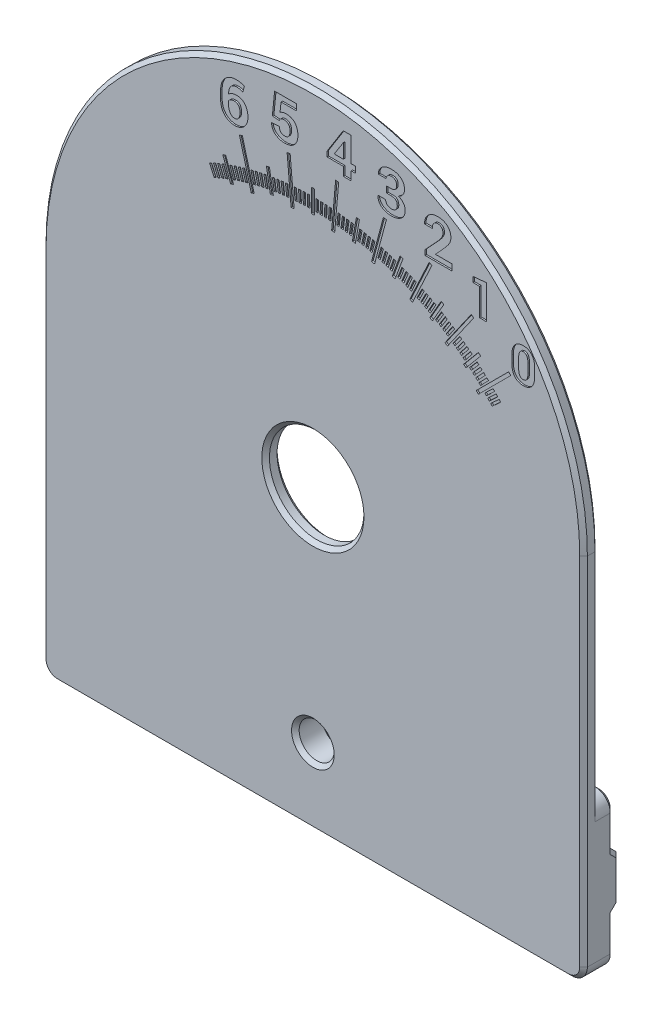
from build123d import *

# Parameters (mm, degrees)
AUFSATZ_LINEAR_AUSTRAGEN1_DEPTH      = 2
SCHNITT_LINEAR_AUSTRAGEN1_DEPTH      = 0.2
SKIZZE4_R                            = 6.2
SCHNITT_LINEAR_AUSTRAGEN2_DEPTH      = 74.378055608
SCHNITT_LINEAR_AUSTRAGEN3_DEPTH      = 0.2
AUFSATZ_LINEAR_AUSTRAGEN2_DEPTH      = 2
AUFSATZ_LINEAR_AUSTRAGEN2_DEPTH_BACK = 2
AUFSATZ_LINEAR_AUSTRAGEN3_DEPTH      = 71
SKIZZE6_R                            = 2.3
SCHNITT_LINEAR_AUSTRAGEN4_DEPTH      = 74.504432279
SKIZZE7_R                            = 4.15
SCHNITT_LINEAR_AUSTRAGEN5_DEPTH      = 2
VERRUNDUNG1_R                        = 1
VERRUNDUNG2_R                        = 2
FASE1_SIZE                           = 0.5


with BuildPart() as part:
    # Skizze1 → Aufsatz-Linear austragen1 (new body)
    with BuildSketch(Plane.XY):
        with BuildLine():
            Line((-35.5, 0), (0, 0))
            Line((0, 0), (35.5, 0))
            Line((35.5, 0), (35.5, 28.687919773))
            ThreePointArc((35.5, 28.687919773), (25.102290732, 53.790210505), (0, 64.187919773))
            ThreePointArc((0, 64.187919773), (-25.102290732, 53.790210505), (-35.5, 28.687919773))
            Line((-35.5, 28.687919773), (-35.5, 0))
        make_face()
    extrude(amount=AUFSATZ_LINEAR_AUSTRAGEN1_DEPTH)

    # Skizze2 → Schnitt-Linear austragen1 (cut)
    with BuildSketch(Plane.XY.offset(2)):
        Polygon((2.857489093, 49.366507143), (3.38042355, 55.343675332), (3.18118461, 55.36110648), (2.981945671, 55.378537629), (2.459011214, 49.40136944), align=None)
        Polygon((2.30193872, 51.919257384), (2.451573328, 51.908793913), (2.346938617, 50.412447837), (2.047669402, 50.433374779), (2.152304113, 51.929720855), align=None)
        Polygon((1.577273434, 51.962268385), (1.4987695, 50.464324083), (1.79835836, 50.448623296), (1.876862295, 51.946567598), (1.727067865, 51.954417991), align=None)
        Polygon((1.001762303, 51.984775289), (0.949413058, 50.485689048), (1.249230306, 50.475219199), (1.301579551, 51.97430544), (1.151670927, 51.979540364), align=None)
        Polygon((0.575923179, 51.99461685), (0.725900334, 51.991998989), (0.699721724, 50.492227446), (0.399767415, 50.497463168), (0.425946025, 51.997234711), align=None)
        Polygon((0, 53), (0.2, 53), (0.2, 50), (-0.2, 50), (-0.2, 53), align=None)
        Polygon((-2.451573328, 51.908793913), (-2.346938617, 50.412447837), (-2.047669402, 50.433374779), (-2.152304113, 51.929720855), (-2.30193872, 51.919257384), align=None)
        Polygon((-1.727067864, 51.954417991), (-1.577273434, 51.962268385), (-1.4987695, 50.464324083), (-1.79835836, 50.448623296), (-1.876862295, 51.946567598), align=None)
        Polygon((-1.151670927, 51.979540364), (-1.001762303, 51.984775289), (-0.949413058, 50.485689048), (-1.249230306, 50.475219199), (-1.301579551, 51.97430544), align=None)
        Polygon((-0.575923179, 51.99461685), (-0.425946025, 51.997234711), (-0.399767415, 50.497463168), (-0.699721724, 50.492227446), (-0.725900334, 51.991998989), align=None)
        Polygon((-2.459011214, 49.40136944), (-2.981945671, 55.378537629), (-3.18118461, 55.36110648), (-3.38042355, 55.343675332), (-2.857489093, 49.366507143), align=None)
        Polygon((-5.162281477, 51.593362492), (-5.014128225, 51.616827662), (-4.779476528, 50.135295151), (-5.07578303, 50.088364811), (-5.310434728, 51.569897322), align=None)
        Polygon((-4.592662627, 51.678492599), (-4.444122416, 51.699368564), (-4.235362765, 50.213966461), (-4.532443186, 50.172214531), (-4.741202837, 51.657616634), align=None)
        Polygon((-4.021644807, 51.753668521), (-3.872762885, 51.771948923), (-3.689958869, 50.283129695), (-3.987722715, 50.246568892), (-4.17052673, 51.73538812), align=None)
        Polygon((-3.449401956, 51.818867359), (-3.300223672, 51.834546628), (-3.143430977, 50.342763785), (-3.441787545, 50.311405246), (-3.59858024, 51.803188089), align=None)
        Polygon((-6.100999591, 52.448733967), (-5.580055058, 49.494310708), (-5.186131957, 49.563769979), (-5.70707649, 52.518193238), (-5.904038041, 52.483463602), align=None)
        Polygon((-7.70079571, 48.512501511), (-8.087166041, 48.408973893), (-9.640080311, 54.204528851), (-9.446895146, 54.25629266), (-9.253709981, 54.308056469), align=None)
        Polygon((-7.983336154, 51.019412431), (-7.837791795, 51.055700715), (-7.474908951, 49.600257126), (-7.765997669, 49.527680557), (-8.128880513, 50.983124147), align=None)
        Polygon((-7.423304453, 51.153864147), (-7.277148944, 51.187606805), (-6.939722362, 49.726051708), (-7.232033381, 49.658566391), (-7.569459963, 51.120121488), align=None)
        Polygon((-6.861011542, 51.278521484), (-6.714289402, 51.309708237), (-6.402421866, 49.842486836), (-6.695866146, 49.780113329), (-7.007733682, 51.24733473), align=None)
        Polygon((-6.296628701, 51.393346471), (-6.149384623, 51.42196782), (-5.86317113, 49.949527045), (-6.157659285, 49.892284346), (-6.443872778, 51.364725121), align=None)
        Polygon((-11.628684873, 50.949549107), (-11.440746349, 51.017953135), (-10.414685919, 48.198875273), (-10.790562967, 48.062067216), (-11.816623397, 50.881145078), align=None)
        Polygon((-10.743632822, 50.201775308), (-10.601805036, 50.250610531), (-10.113452804, 48.832332667), (-10.397108377, 48.734662221), (-10.885460608, 50.152940084), align=None)
        Polygon((-10.197450451, 50.384525373), (-10.054791973, 50.430877922), (-9.591266482, 49.004293147), (-9.876583436, 48.911588049), (-10.340108928, 50.338172824), align=None)
        Polygon((-9.648161837, 50.557715407), (-9.504716123, 50.601571163), (-9.066158566, 49.167114029), (-9.353049993, 49.079402518), (-9.79160755, 50.513859652), align=None)
        Polygon((-9.095934299, 50.721292656), (-8.951745045, 50.76263826), (-8.538289011, 49.320745716), (-8.82666752, 49.238054509), (-9.240123554, 50.679947053), align=None)
        Polygon((-13.422163958, 49.146673834), (-13.285132139, 49.207684331), (-12.675027174, 47.837366144), (-12.949090812, 47.715345151), (-13.559195776, 49.085663338), align=None)
        Polygon((-12.893987693, 49.37633141), (-12.755911964, 49.43494108), (-12.169815272, 48.054183799), (-12.445966728, 47.936964461), (-13.032063421, 49.317721741), align=None)
        Polygon((-12.361883794, 49.596736062), (-12.222806216, 49.652927051), (-11.660896326, 48.262151269), (-11.939051482, 48.149769291), (-12.500961372, 49.540545073), align=None)
        Polygon((-11.826014346, 49.807820651), (-11.685977282, 49.861575843), (-11.148425357, 48.461205204), (-11.428499485, 48.353694819), (-11.96605141, 49.754065458), align=None)
        Polygon((3.300223672, 51.834546628), (3.143430977, 50.342763785), (3.441787545, 50.311405246), (3.59858024, 51.803188089), (3.449401956, 51.818867359), align=None)
        Polygon((4.021644807, 51.753668521), (4.17052673, 51.73538812), (3.987722715, 50.246568892), (3.68995887, 50.283129695), (3.872762885, 51.771948923), align=None)
        Polygon((4.592662627, 51.678492599), (4.741202837, 51.657616634), (4.532443186, 50.172214531), (4.235362765, 50.213966461), (4.444122416, 51.699368564), align=None)
        Polygon((5.162281477, 51.593362492), (5.310434728, 51.569897322), (5.07578303, 50.088364811), (4.779476528, 50.135295151), (5.014128225, 51.616827662), align=None)
        Polygon((5.70707649, 52.518193238), (5.186131957, 49.563769979), (5.580055058, 49.494310708), (6.100999591, 52.448733967), (5.904038041, 52.483463602), align=None)
        Polygon((6.296628701, 51.393346471), (6.443872778, 51.364725121), (6.157659285, 49.892284346), (5.86317113, 49.949527045), (6.149384623, 51.42196782), align=None)
        Polygon((6.861011542, 51.278521484), (7.007733683, 51.24733473), (6.695866146, 49.780113329), (6.402421866, 49.842486836), (6.714289402, 51.309708237), align=None)
        Polygon((7.423304453, 51.153864147), (7.569459963, 51.120121488), (7.232033381, 49.658566391), (6.939722362, 49.726051708), (7.277148944, 51.187606805), align=None)
        Polygon((7.983336154, 51.019412431), (8.128880513, 50.983124147), (7.765997669, 49.527680557), (7.474908951, 49.600257126), (7.837791795, 51.055700715), align=None)
        Polygon((8.087166041, 48.408973893), (9.640080312, 54.204528851), (9.446895146, 54.25629266), (9.253709981, 54.308056469), (7.70079571, 48.512501511), align=None)
        Polygon((9.0959343, 50.721292656), (9.240123554, 50.679947053), (8.82666752, 49.238054509), (8.538289011, 49.320745716), (8.951745045, 50.76263826), align=None)
        Polygon((9.648161837, 50.557715407), (9.79160755, 50.513859652), (9.353049993, 49.079402518), (9.066158566, 49.167114029), (9.504716123, 50.601571163), align=None)
        Polygon((10.197450451, 50.384525373), (10.340108928, 50.338172824), (9.876583436, 48.911588049), (9.591266482, 49.004293147), (10.054791973, 50.430877922), align=None)
        Polygon((10.743632822, 50.201775308), (10.885460608, 50.152940084), (10.397108377, 48.734662221), (10.113452804, 48.832332667), (10.601805036, 50.250610531), align=None)
        Polygon((11.628684873, 50.949549107), (11.816623397, 50.881145078), (10.790562967, 48.062067216), (10.414685919, 48.198875273), (11.440746349, 51.017953135), align=None)
        Polygon((11.826014346, 49.807820651), (11.96605141, 49.754065458), (11.428499485, 48.353694819), (11.148425357, 48.461205204), (11.685977282, 49.861575843), align=None)
        Polygon((12.361883794, 49.596736062), (12.500961372, 49.540545073), (11.939051482, 48.149769291), (11.660896326, 48.262151269), (12.222806216, 49.652927051), align=None)
        Polygon((12.893987693, 49.37633141), (13.032063421, 49.317721741), (12.445966728, 47.936964461), (12.169815272, 48.054183799), (12.755911965, 49.43494108), align=None)
        Polygon((13.422163958, 49.146673834), (13.559195776, 49.085663338), (12.949090812, 47.715345151), (12.675027174, 47.837366144), (13.285132139, 49.207684331), align=None)
        Polygon((13.071118541, 46.557863852), (12.708595426, 46.726911157), (15.244304996, 52.164757879), (15.425566554, 52.080234227), (15.606828111, 51.995710574), align=None)
        Polygon((21.854778729, 45.045511066), (22.007987618, 44.916953544), (20.079624789, 42.618820215), (19.773207012, 42.875935259), (21.701569841, 45.174068588), align=None)
        Polygon((20.767348146, 44.645539174), (20.88392004, 44.551141116), (19.939939454, 43.385422174), (19.706795665, 43.574218291), (20.650776252, 44.739937233), align=None)
        Polygon((20.316608805, 45.004073435), (20.434810418, 44.911724214), (19.511318205, 43.729708083), (19.274914979, 43.914406526), (20.198407192, 45.096422656), align=None)
        Polygon((19.859680829, 45.354686603), (19.979476155, 45.264414349), (19.076753621, 44.066461084), (18.837162968, 44.247005591), (19.739885502, 45.444958856), align=None)
        Polygon((19.396703401, 45.697271878), (19.51805595, 45.60910409), (18.636378072, 44.395578599), (18.393672974, 44.571914174), (19.275350852, 45.785439666), align=None)
        Polygon((17.657911718, 43.869422064), (17.3302509, 44.098852638), (20.771709518, 49.013764904), (20.935539927, 48.899049617), (21.099370336, 48.784334329), align=None)
        Polygon((18.453166102, 46.357943808), (18.577521738, 46.274064872), (17.738732382, 45.030508513), (17.490021111, 45.198266384), (18.328810466, 46.441822743), align=None)
        Polygon((17.97289364, 46.675829215), (18.098694226, 46.59413336), (17.281735673, 45.336127508), (17.030134503, 45.499519219), (17.847093055, 46.757525071), align=None)
        Polygon((17.487146462, 46.985284297), (17.614353676, 46.905796407), (16.81947478, 45.633724263), (16.565060351, 45.792700043), (17.359939247, 47.064772187), align=None)
        Polygon((16.996072529, 47.28621479), (17.124647624, 47.208959079), (16.352090512, 45.923208128), (16.094940321, 46.07771955), (16.867497434, 47.363470501), align=None)
        Polygon((17, 48.444863729), (17.173205081, 48.344863729), (15.673205081, 45.746787517), (15.326794919, 45.946787517), (16.826794919, 48.544863729), align=None)
        Polygon((15.998544321, 47.86213797), (16.129737277, 47.789416527), (15.402522847, 46.477486966), (15.140136934, 46.622929852), (15.867351365, 47.934859413), align=None)
        Polygon((15.492393903, 48.136955224), (15.624836042, 48.06653449), (14.920628697, 46.7421131), (14.655744419, 46.882954569), (15.359951764, 48.207375959), align=None)
        Polygon((14.981524351, 48.40289708), (15.11517533, 48.334798505), (14.43418958, 46.998288719), (14.166887623, 47.134485868), (14.847873372, 48.470995655), align=None)
        Polygon((14.466091282, 48.659882528), (14.600910389, 48.594126856), (13.943353669, 47.245935787), (13.673715455, 47.377447131), (14.331272175, 48.7256382), align=None)
        Polygon((24.52351383, 41.081071033), (24.623883421, 40.969599309), (23.509166183, 39.9659034), (23.308427001, 40.188846848), (24.423144239, 41.192542757), align=None)
        Polygon((24.134410954, 41.50570231), (24.236710708, 41.395999255), (23.139680156, 40.373001714), (22.935080648, 40.592407825), (24.0321112, 41.615405365), align=None)
        Polygon((23.737956503, 41.923478131), (23.842155258, 41.815577161), (22.763145558, 40.773589606), (22.554748047, 40.989391546), (23.633757747, 42.031379102), align=None)
        Polygon((21.42533547, 40.708178182), (25.667976157, 44.95081887), (25.809397513, 44.809397513), (25.95081887, 44.667976157), (21.708178182, 40.42533547), align=None)
        Polygon((22.923478131, 42.737956503), (23.031379102, 42.633757747), (21.989391546, 41.554748047), (21.773589606, 41.763145558), (22.815577161, 42.842155258), align=None)
        Polygon((22.50570231, 43.134410954), (22.615405365, 43.0321112), (21.592407825, 41.935080648), (21.373001715, 42.139680156), (22.395999255, 43.236710708), align=None)
        Polygon((22.081071033, 43.52351383), (22.192542757, 43.423144239), (21.188846848, 42.308427001), (20.9659034, 42.509166183), (21.969599309, 43.623883421), align=None)
        Polygon((21.649713649, 43.905146607), (21.762920086, 43.806737752), (20.778831542, 42.674673382), (20.552418668, 42.871491091), (21.536507212, 44.003555461), align=None)
    extrude(amount=-SCHNITT_LINEAR_AUSTRAGEN1_DEPTH, mode=Mode.SUBTRACT)

    # Skizze4 → Schnitt-Linear austragen2 (cut, through all)
    with BuildSketch(Plane.XY.offset(2)):
        with Locations((0, 19)):
            Circle(SKIZZE4_R)
    extrude(amount=-SCHNITT_LINEAR_AUSTRAGEN2_DEPTH, mode=Mode.SUBTRACT)

    # Skizze3 → Schnitt-Linear austragen3 (cut)
    # profile 1 of 7: a face of its own
    with BuildSketch(Plane.XY.offset(2)):
        with BuildLine():
            add(Edge.make_bspline(
                [(26.098559086, 46.122833513), (26.099690166, 46.051677694), (26.101885004, 45.913601231), (26.121026395, 45.713253722), (26.152043006, 45.52629491), (26.196004084, 45.352412786), (26.252740372, 45.19186021), (26.320749425, 45.043645185), (26.403490685, 44.909590132), (26.49781734, 44.788606495), (26.603615057, 44.682414187), (26.718008102, 44.589320208), (26.841672199, 44.510987764), (26.974148357, 44.446503401), (27.115528963, 44.39680547), (27.265917532, 44.362259655), (27.424999392, 44.339856432), (27.53420902, 44.337338229), (27.590096119, 44.336049559)],
                knots=[0, 0, 0, 0, 1.293224978, 2.509477586, 3.654535947, 4.735320651, 5.765195443, 6.746129847, 7.69374496, 8.622268829, 9.528613081, 10.412810147, 11.297982386, 12.183473846, 13.085672909, 14.015733381, 14.984568415, 16, 16, 16, 16], degree=3))
            add(Edge.make_bspline(
                [(27.590096119, 44.336049559), (27.646279821, 44.337358967), (27.756377811, 44.33992489), (27.91668914, 44.362135198), (28.06849625, 44.396976301), (28.211161218, 44.4463415), (28.344706398, 44.510678307), (28.468601838, 44.589925111), (28.584608654, 44.681757974), (28.690387659, 44.788703831), (28.784890174, 44.90953368), (28.867343359, 45.04388412), (28.936693709, 45.191605696), (28.993108202, 45.352451378), (29.03717433, 45.526283687), (29.068160373, 45.713256994), (29.087310564, 45.91360033), (29.089504149, 46.051677388), (29.090634583, 46.122833513)],
                knots=[0, 0, 0, 0, 1.017853048, 1.994592204, 2.927189021, 3.836976819, 4.724735696, 5.607282636, 6.497337057, 7.400993217, 8.32676321, 9.271567827, 10.251903337, 11.278723662, 12.356302906, 13.497965181, 14.71061055, 16, 16, 16, 16], degree=3))
            Line((29.090634583, 46.122833513), (29.090634583, 47.097688435))
            add(Edge.make_bspline(
                [(29.090634583, 47.097688435), (29.08950819, 47.168545082), (29.087322711, 47.306024364), (29.068095523, 47.505760148), (29.03716009, 47.692429838), (28.993174126, 47.866299805), (28.93650274, 48.02689257), (28.868165463, 48.17520072), (28.786035047, 48.309949966), (28.691068356, 48.431025758), (28.585653194, 48.538137334), (28.471157819, 48.631960182), (28.347641387, 48.711799546), (28.214103367, 48.775275102), (28.072735275, 48.826906497), (27.921708286, 48.860737815), (27.762111817, 48.883458088), (27.652590286, 48.885913168), (27.59639712, 48.887172818)],
                knots=[0, 0, 0, 0, 1.286043053, 2.495239076, 3.63875912, 4.718091855, 5.746583072, 6.726199649, 7.677185986, 8.604462438, 9.513465084, 10.399911598, 11.286826565, 12.176030047, 13.078842803, 14.012957188, 14.980490652, 16, 16, 16, 16], degree=3))
            add(Edge.make_bspline(
                [(27.59639712, 48.887172818), (27.540507987, 48.885889332), (27.431294384, 48.883381258), (27.272240914, 48.860905696), (27.121376544, 48.826533717), (26.980017314, 48.775713334), (26.846716971, 48.711595899), (26.723312108, 48.631401421), (26.607154543, 48.538822666), (26.501904537, 48.430631338), (26.405592938, 48.310358031), (26.324201284, 48.174676549), (26.253025028, 48.027433216), (26.197354237, 47.866072959), (26.151669495, 47.692611816), (26.121207265, 47.505728828), (26.101840971, 47.30603297), (26.09967528, 47.168548009), (26.098559086, 47.097688435)],
                knots=[0, 0, 0, 0, 1.013603384, 1.980694112, 2.909080086, 3.816605871, 4.700503077, 5.587012198, 6.481510149, 7.390096843, 8.320316897, 9.27086807, 10.254687322, 11.282707909, 12.362905948, 13.505902726, 14.71454543, 16, 16, 16, 16], degree=3))
            Line((26.098559086, 47.097688435), (26.098559086, 46.122833513))
        make_face()
        with BuildLine():
            add(Edge.make_bspline(
                [(26.982499561, 47.186802597), (26.983079851, 47.228817086), (26.984204014, 47.310209333), (26.991051042, 47.428020495), (27.003790108, 47.537037085), (27.02040355, 47.637596472), (27.042970356, 47.729270139), (27.069461951, 47.812690551), (27.101950091, 47.886799394), (27.138958077, 47.95235282), (27.180725085, 48.009688488), (27.22687911, 48.05962675), (27.277411162, 48.102391648), (27.332868177, 48.137023419), (27.392818673, 48.162972575), (27.456823872, 48.182118858), (27.525136363, 48.194107292), (27.57234363, 48.195270346), (27.59639712, 48.195862956)],
                knots=[0, 0, 0, 0, 1.513594036, 2.932198428, 4.248801102, 5.466039263, 6.601180113, 7.647133637, 8.615119174, 9.510694161, 10.353858007, 11.16459791, 11.954831597, 12.731645245, 13.510861571, 14.300799512, 15.134207414, 16, 16, 16, 16], degree=3))
            add(Edge.make_bspline(
                [(27.59639712, 48.195862956), (27.620755768, 48.195298193), (27.668273169, 48.194196487), (27.737111088, 48.18193), (27.801315074, 48.163361539), (27.861059086, 48.136807317), (27.915931367, 48.102299347), (27.967145063, 48.060882612), (28.011918263, 48.01017537), (28.053981997, 47.953540953), (28.089947689, 47.887618948), (28.121089454, 47.813617565), (28.14854941, 47.730991063), (28.169232757, 47.639219462), (28.186789788, 47.538641769), (28.197694779, 47.429132412), (28.205129164, 47.31082466), (28.206160106, 47.229122305), (28.206694108, 47.186802597)],
                knots=[0, 0, 0, 0, 0.876860946, 1.710528188, 2.511074245, 3.280646496, 4.057701873, 4.841274337, 5.644953943, 6.488380164, 7.378933073, 8.342924242, 9.378929121, 10.511897991, 11.72951493, 13.056079329, 14.475125161, 16, 16, 16, 16], degree=3))
            Line((28.206694108, 47.186802597), (28.206694108, 46.041820638))
            add(Edge.make_bspline(
                [(28.206694108, 46.041820638), (28.206141222, 45.999203285), (28.205069672, 45.916606455), (28.19786326, 45.797368044), (28.186455019, 45.686749148), (28.169900737, 45.585280458), (28.146949204, 45.493189967), (28.121284761, 45.409498457), (28.090320804, 45.334621905), (28.052838378, 45.269119345), (28.011408837, 45.211841292), (27.964962232, 45.162299882), (27.913358706, 45.121190457), (27.857999487, 45.085877947), (27.797219665, 45.060302505), (27.732366847, 45.041090852), (27.662851893, 45.029069067), (27.614749213, 45.02793873), (27.590096119, 45.027359421)],
                knots=[0, 0, 0, 0, 1.523541514, 2.952780733, 4.26885555, 5.497995718, 6.624511075, 7.659241543, 8.625484964, 9.514254825, 10.351011797, 11.147758987, 11.933453846, 12.70436479, 13.487492611, 14.281708487, 15.119358806, 16, 16, 16, 16], degree=3))
            add(Edge.make_bspline(
                [(27.590096119, 45.027359421), (27.566041039, 45.027948511), (27.51883065, 45.029104654), (27.450540506, 45.041142563), (27.386719283, 45.060034469), (27.327292024, 45.086463398), (27.272320293, 45.120546822), (27.222417991, 45.16300088), (27.175873495, 45.211498281), (27.135486465, 45.26921702), (27.098931184, 45.334828305), (27.068160079, 45.409660032), (27.04079426, 45.492869567), (27.019719696, 45.585461653), (27.002607687, 45.686715676), (26.991369711, 45.797378089), (26.984113053, 45.916603658), (26.983048722, 45.999202333), (26.982499561, 46.041820638)],
                knots=[0, 0, 0, 0, 0.864034539, 1.695750155, 2.484084077, 3.251854749, 4.027091029, 4.800524082, 5.601741566, 6.43687774, 7.325345853, 8.297010558, 9.340840207, 10.471156781, 11.707193262, 13.030652156, 14.46791038, 16, 16, 16, 16], degree=3))
            Line((26.982499561, 46.041820638), (26.982499561, 47.186802597))
        make_face(mode=Mode.SUBTRACT)
    # profile 2 of 7: a face of its own
    with BuildSketch(Plane.XY.offset(2)):
        Polygon((22.767063705, 49.188254904), (21.879522658, 49.188254904), (21.879522658, 52.760022525), (20.980279751, 52.760022525), (20.980279751, 53.451332387), (22.767063705, 53.624159852), align=None)
    # profile 3 of 7: a face of its own
    with BuildSketch(Plane.XY.offset(2)):
        with BuildLine():
            Line((18.250657749, 52.694426012), (14.72734783, 52.694426012))
            Line((14.72734783, 52.694426012), (14.72734783, 53.371783656))
            Line((14.72734783, 53.371783656), (16.397113186, 55.164418539))
            add(Edge.make_bspline(
                [(16.397113186, 55.164418539), (16.426202627, 55.19834258), (16.482628627, 55.264146458), (16.564282384, 55.360554658), (16.637450376, 55.45427822), (16.704756511, 55.543490446), (16.766193822, 55.628595423), (16.82009233, 55.710320802), (16.869437106, 55.786907959), (16.922494517, 55.883066122), (16.977439611, 55.997938923), (17.027014361, 56.13289196), (17.056835279, 56.263688149), (17.060938848, 56.349571221), (17.062918995, 56.391013468)],
                knots=[0, 0, 0, 0, 1.130201503, 2.192299003, 3.19471889, 4.136675979, 5.018646322, 5.848561577, 6.612434428, 7.32183259, 8.624693034, 9.828826393, 10.952316075, 12, 12, 12, 12], degree=3))
            add(Edge.make_bspline(
                [(17.062918995, 56.391013468), (17.061268078, 56.443028394), (17.058083878, 56.543352011), (17.023442313, 56.68585948), (16.968236282, 56.813781702), (16.904227723, 56.907775357), (16.842463233, 56.972340337), (16.79165614, 57.015059495), (16.735661244, 57.05053627), (16.675691463, 57.080502143), (16.61043496, 57.102093227), (16.541405831, 57.119344814), (16.467022881, 57.128583189), (16.416038863, 57.129736533), (16.389762018, 57.130330959)],
                knots=[0, 0, 0, 0, 1.655323007, 3.192698795, 4.641888052, 6.078130153, 6.788470776, 7.48571807, 8.188391495, 8.897064752, 9.61698265, 10.374821007, 11.162392891, 12, 12, 12, 12], degree=3))
            add(Edge.make_bspline(
                [(16.389762018, 57.130330959), (16.360690657, 57.129352545), (16.304454519, 57.127459884), (16.222104528, 57.117721785), (16.146091566, 57.097045867), (16.074315804, 57.071389994), (16.009424901, 57.035864058), (15.947948121, 56.995118371), (15.894106685, 56.943950375), (15.827184845, 56.867817264), (15.75966493, 56.7548568), (15.700070872, 56.60134044), (15.665840372, 56.426802482), (15.661937012, 56.304000131), (15.659896029, 56.239789436)],
                knots=[0, 0, 0, 0, 0.803328737, 1.553972886, 2.283208037, 2.974548257, 3.65354395, 4.321227461, 5.005365316, 5.697448659, 7.116752574, 8.610426722, 10.227665392, 12, 12, 12, 12], degree=3))
            Line((15.659896029, 56.239789436), (14.65278598, 56.239789436))
            Line((14.65278598, 56.239789436), (14.646484979, 56.261842941))
            add(Edge.make_bspline(
                [(14.646484979, 56.261842941), (14.646344666, 56.318961587), (14.646068342, 56.431447378), (14.666169371, 56.596986277), (14.698648625, 56.756466159), (14.750145768, 56.908483418), (14.815488579, 57.054105476), (14.895588168, 57.194016605), (14.992827428, 57.326127655), (15.103883915, 57.450602659), (15.226788304, 57.565518143), (15.363287199, 57.664012712), (15.509122744, 57.74882236), (15.665334669, 57.818455068), (15.83194737, 57.871957895), (16.008956075, 57.909375699), (16.195882551, 57.933146429), (16.32422773, 57.93560418), (16.389762018, 57.936859132)],
                knots=[0, 0, 0, 0, 1.006598135, 1.982329648, 2.935370304, 3.872578786, 4.806690666, 5.747147714, 6.71043374, 7.694413539, 8.68626561, 9.671793948, 10.656683809, 11.657241959, 12.682360224, 13.737171641, 14.844577974, 16, 16, 16, 16], degree=3))
            add(Edge.make_bspline(
                [(16.389762018, 57.936859132), (16.4545811, 57.935831135), (16.580695314, 57.933831029), (16.764622808, 57.913043394), (16.937853178, 57.881108283), (17.100877971, 57.836171775), (17.25267191, 57.77700576), (17.394069773, 57.705781228), (17.524647533, 57.620819492), (17.643845983, 57.52347838), (17.750997794, 57.415526453), (17.844276305, 57.298386993), (17.92227646, 57.171799287), (17.988208878, 57.037575551), (18.037021632, 56.893307852), (18.073019504, 56.741489582), (18.094136209, 56.580634959), (18.096944426, 56.470538265), (18.09838355, 56.41411714)],
                knots=[0, 0, 0, 0, 1.20299858, 2.340594996, 3.431738373, 4.470911711, 5.475086931, 6.451710196, 7.405333875, 8.361523203, 9.303649502, 10.224278562, 11.135035875, 12.059396781, 12.99459294, 13.956222527, 14.952627729, 16, 16, 16, 16], degree=3))
            add(Edge.make_bspline(
                [(18.09838355, 56.41411714), (18.097478296, 56.375586361), (18.095672056, 56.298706501), (18.084169866, 56.184569074), (18.06410117, 56.072590623), (18.035700314, 55.963035142), (17.998816912, 55.856106912), (17.954314877, 55.751159966), (17.902039279, 55.648677235), (17.840594233, 55.547075422), (17.770001217, 55.443256255), (17.690125525, 55.332956711), (17.599283467, 55.215339421), (17.498760778, 55.08939353), (17.386928466, 54.956063888), (17.265386803, 54.814379621), (17.133014629, 54.665264435), (17.040315238, 54.564287037), (16.992557814, 54.5122649)],
                knots=[0, 0, 0, 0, 0.819681115, 1.635496908, 2.437429982, 3.237563136, 4.040601849, 4.841427758, 5.660702856, 6.485711229, 7.365559948, 8.330794508, 9.382339535, 10.526714813, 11.758579549, 13.084033786, 14.497735187, 16, 16, 16, 16], degree=3))
            Line((16.992557814, 54.5122649), (16.074711951, 53.518807021))
            Line((16.074711951, 53.518807021), (16.081012952, 53.500954184))
            Line((16.081012952, 53.500954184), (18.250657749, 53.500954184))
            Line((18.250657749, 53.500954184), (18.250657749, 52.694426012))
        make_face()
    # profile 4 of 7: a face of its own
    with BuildSketch(Plane.XY.offset(2)):
        with BuildLine():
            Line((9.682676624, 58.062290858), (10.263418914, 58.062290858))
            add(Edge.make_bspline(
                [(10.263418914, 58.062290858), (10.29318656, 58.062981628), (10.350744797, 58.064317289), (10.434517592, 58.072147997), (10.512052749, 58.088211626), (10.583731708, 58.109156064), (10.649957296, 58.134822166), (10.708764453, 58.169382759), (10.763119914, 58.207836422), (10.826040455, 58.268846279), (10.892658383, 58.358752838), (10.948225514, 58.486137783), (10.980721399, 58.63197786), (10.984826997, 58.734923244), (10.986983902, 58.789006347)],
                knots=[0, 0, 0, 0, 0.914553824, 1.76836643, 2.580253338, 3.342411023, 4.061239369, 4.754771654, 5.43228097, 6.101548608, 7.439219812, 8.839970804, 10.339855787, 12, 12, 12, 12], degree=3))
            add(Edge.make_bspline(
                [(10.986983902, 58.789006347), (10.984779347, 58.838544105), (10.98055216, 58.933531665), (10.948016044, 59.068718927), (10.891426084, 59.18779839), (10.812708427, 59.290262079), (10.71248985, 59.37392268), (10.590797868, 59.433132773), (10.449475718, 59.468140853), (10.349046817, 59.47178786), (10.295974088, 59.47371516)],
                knots=[0, 0, 0, 0, 1.077390169, 2.065871913, 3.002906801, 3.92627892, 4.8567882, 5.81752214, 6.846646199, 8, 8, 8, 8], degree=3))
            add(Edge.make_bspline(
                [(10.295974088, 59.47371516), (10.249223714, 59.471844659), (10.158436326, 59.46821222), (10.028185877, 59.435762423), (9.909489908, 59.3827248), (9.804825493, 59.309220882), (9.716732237, 59.219788685), (9.652814667, 59.113854163), (9.614882432, 58.993851713), (9.610421215, 58.909353801), (9.608114774, 58.86566853)],
                knots=[0, 0, 0, 0, 1.091347957, 2.119354807, 3.115508217, 4.114312984, 5.092287627, 6.028284367, 6.98062652, 8, 8, 8, 8], degree=3))
            Line((9.608114774, 58.86566853), (8.605205393, 58.86566853))
            Line((8.605205393, 58.86566853), (8.597854225, 58.886671868))
            add(Edge.make_bspline(
                [(8.597854225, 58.886671868), (8.597862028, 58.936075571), (8.59787736, 59.033143467), (8.615772755, 59.176069117), (8.650453101, 59.31224245), (8.701743055, 59.44126459), (8.766683076, 59.56441692), (8.84999897, 59.67933524), (8.948324411, 59.788032126), (9.061331286, 59.888865388), (9.185344744, 59.980797661), (9.3185959, 60.060602398), (9.458543811, 60.129980751), (9.606974045, 60.183451336), (9.761643811, 60.22716986), (9.923472216, 60.258832433), (10.093248322, 60.276429047), (10.208770948, 60.278956047), (10.267619582, 60.280243332)],
                knots=[0, 0, 0, 0, 0.971433052, 1.908661826, 2.825831849, 3.72887428, 4.634854123, 5.558082394, 6.513957333, 7.513862166, 8.533314942, 9.546863344, 10.566525527, 11.601680878, 12.646235311, 13.726933008, 14.842071981, 16, 16, 16, 16], degree=3))
            add(Edge.make_bspline(
                [(10.267619582, 60.280243332), (10.33276816, 60.278991301), (10.459817412, 60.276549658), (10.645221198, 60.258801772), (10.820325907, 60.228213193), (10.98549637, 60.18653104), (11.141014659, 60.132930974), (11.286528861, 60.066914476), (11.421329242, 59.987625526), (11.545892781, 59.897674381), (11.657057209, 59.795396011), (11.756042525, 59.684082149), (11.838243993, 59.560799628), (11.906279464, 59.427788832), (11.956955193, 59.283722612), (11.995427137, 59.13060109), (12.017368655, 58.966769971), (12.020030979, 58.854180812), (12.02139829, 58.796357515)],
                knots=[0, 0, 0, 0, 1.202350265, 2.344758785, 3.433509486, 4.480273052, 5.485558999, 6.465678061, 7.424178624, 8.367556782, 9.295880958, 10.206957814, 11.110096606, 12.023164339, 12.957137052, 13.922407568, 14.932994557, 16, 16, 16, 16], degree=3))
            add(Edge.make_bspline(
                [(12.02139829, 58.796357515), (12.01868507, 58.740464522), (12.013241096, 58.628317331), (11.971477808, 58.463119465), (11.904199358, 58.302124679), (11.810749635, 58.148523734), (11.695810307, 58.003829824), (11.557201621, 57.876962427), (11.401202976, 57.762949628), (11.284128753, 57.705286524), (11.22432162, 57.675829442)],
                knots=[0, 0, 0, 0, 0.923568303, 1.853105091, 2.800321715, 3.800126825, 4.817280111, 5.845445204, 6.899349993, 8, 8, 8, 8], degree=3))
            add(Edge.make_bspline(
                [(11.22432162, 57.675829442), (11.25921889, 57.663110842), (11.327973837, 57.638052529), (11.425273588, 57.591049937), (11.517193116, 57.540900229), (11.602565446, 57.485534498), (11.680215801, 57.423598796), (11.753811419, 57.359261387), (11.81820658, 57.286748313), (11.878694361, 57.211835263), (11.930788051, 57.131459885), (11.977419901, 57.048621989), (12.016395997, 56.962158294), (12.047910495, 56.872110183), (12.073114756, 56.779142479), (12.091059652, 56.682590832), (12.101733315, 56.583201364), (12.102782547, 56.515771169), (12.103311307, 56.481789687)],
                knots=[0, 0, 0, 0, 1.120253685, 2.207134899, 3.256825285, 4.279426835, 5.272686463, 6.252654901, 7.224791012, 8.194916023, 9.155968035, 10.111254556, 11.061621717, 12.013865917, 12.987665222, 13.965638666, 14.974782539, 16, 16, 16, 16], degree=3))
            add(Edge.make_bspline(
                [(12.103311307, 56.481789687), (12.101689694, 56.424640731), (12.098511045, 56.312618689), (12.073887468, 56.149626653), (12.034454829, 55.995706941), (11.976823304, 55.851840837), (11.904604315, 55.7167409), (11.814942513, 55.591483352), (11.709775967, 55.47562542), (11.588317471, 55.371168156), (11.455421534, 55.276876887), (11.312098194, 55.194990632), (11.159989574, 55.125196256), (10.998887062, 55.068724422), (10.82888743, 55.024441258), (10.649760722, 54.993316216), (10.461623734, 54.974041405), (10.333127179, 54.971761717), (10.267619582, 54.970599531)],
                knots=[0, 0, 0, 0, 1.025367643, 2.009901578, 2.951707542, 3.871094167, 4.784730599, 5.694795376, 6.628835862, 7.586354917, 8.564351436, 9.54940649, 10.544667988, 11.564089407, 12.609511871, 13.69413209, 14.824467596, 16, 16, 16, 16], degree=3))
            add(Edge.make_bspline(
                [(10.267619582, 54.970599531), (10.208759669, 54.971828637), (10.092866691, 54.974248702), (9.922006869, 54.992849597), (9.757058137, 55.021258827), (9.599148295, 55.064349358), (9.446589673, 55.115849926), (9.302001929, 55.183179736), (9.162260156, 55.259566524), (9.031002695, 55.348294875), (8.909719427, 55.446835599), (8.805210714, 55.557945361), (8.716812418, 55.678659801), (8.646108036, 55.809872188), (8.592609508, 55.950900881), (8.554297843, 56.100851014), (8.534558725, 56.261060823), (8.534053699, 56.370773323), (8.533794045, 56.427181009)],
                knots=[0, 0, 0, 0, 1.106745865, 2.179141426, 3.229072102, 4.251117884, 5.254675966, 6.253406777, 7.24647975, 8.247118274, 9.229152981, 10.179243012, 11.107620555, 12.035531108, 12.973315181, 13.937758454, 14.939717239, 16, 16, 16, 16], degree=3))
            Line((8.533794045, 56.427181009), (8.541145213, 56.448184346))
            Line((8.541145213, 56.448184346), (9.544054594, 56.448184346))
            add(Edge.make_bspline(
                [(9.544054594, 56.448184346), (9.546587759, 56.401325695), (9.551525053, 56.309995326), (9.592863257, 56.179903856), (9.661234236, 56.06356178), (9.753831287, 55.962063129), (9.867288434, 55.878832608), (9.997966239, 55.819931108), (10.142358795, 55.782736596), (10.243577804, 55.779040827), (10.295974088, 55.777127703)],
                knots=[0, 0, 0, 0, 0.996216098, 1.941685936, 2.873776926, 3.850130657, 4.847656851, 5.848381367, 6.886209016, 8, 8, 8, 8], degree=3))
            add(Edge.make_bspline(
                [(10.295974088, 55.777127703), (10.352934078, 55.778852781), (10.461538744, 55.782141957), (10.614696296, 55.820437262), (10.749875663, 55.87965279), (10.845576742, 55.951413133), (10.910012187, 56.018663116), (10.952303767, 56.073585526), (10.988419823, 56.132996548), (11.017789117, 56.196758416), (11.039466888, 56.26502753), (11.056985189, 56.33680247), (11.065982816, 56.413298686), (11.06721854, 56.465668014), (11.067846753, 56.492291356)],
                knots=[0, 0, 0, 0, 1.719697988, 3.278919543, 4.743586949, 6.158550459, 6.862674917, 7.557498302, 8.251352391, 8.962215036, 9.67559792, 10.415455634, 11.194454683, 12, 12, 12, 12], degree=3))
            add(Edge.make_bspline(
                [(11.067846753, 56.492291356), (11.06726933, 56.524167629), (11.066149835, 56.585968624), (11.056796969, 56.675230855), (11.040757786, 56.758042459), (11.019934642, 56.834678544), (10.989073338, 56.903553343), (10.955525349, 56.967470423), (10.912508865, 57.023006905), (10.865151983, 57.073289781), (10.810680949, 57.11643589), (10.750702331, 57.154547873), (10.683994471, 57.18611272), (10.611232134, 57.210861993), (10.532941522, 57.23090162), (10.448721646, 57.245676059), (10.358093384, 57.253791993), (10.29563953, 57.255091999), (10.263418914, 57.255762686)],
                knots=[0, 0, 0, 0, 1.199639622, 2.32583404, 3.372369142, 4.373201741, 5.305702195, 6.207924693, 7.082794816, 7.940126676, 8.802304539, 9.690565305, 10.609941857, 11.572489284, 12.579115839, 13.649189956, 14.787191759, 16, 16, 16, 16], degree=3))
            Line((10.263418914, 57.255762686), (9.682676624, 57.255762686))
            Line((9.682676624, 57.255762686), (9.682676624, 58.062290858))
        make_face()
    # profile 5 of 7: a face of its own
    with BuildSketch(Plane.XY.offset(2)):
        Polygon((5.018780644, 58.264378378), (5.603723603, 58.264378378), (5.603723603, 57.457850206), (5.018780644, 57.457850206), (5.018780644, 56.315268628), (3.987516757, 56.315268628), (3.987516757, 57.457850206), (1.881932141, 57.457850206), (1.835724798, 58.076398504), (3.977015088, 61.490491067), (5.018780644, 61.490491067), align=None)
        Polygon((2.799778004, 58.264378378), (3.987516757, 58.264378378), (3.987516757, 60.108471439), (3.96651342, 60.115822607), (3.884600402, 59.971949743), align=None, mode=Mode.SUBTRACT)
    # profile 6 of 7: a face of its own
    with BuildSketch(Plane.XY.offset(2)):
        with BuildLine():
            Line((-5.319128375, 58.5237696), (-5.020880978, 61.490491067))
            Line((-5.020880978, 61.490491067), (-2.143423697, 61.490491067))
            Line((-2.143423697, 61.490491067), (-2.143423697, 60.683962895))
            Line((-2.143423697, 60.683962895), (-4.174446464, 60.683962895))
            Line((-4.174446464, 60.683962895), (-4.316218994, 59.426913126))
            add(Edge.make_bspline(
                [(-4.316218994, 59.426913126), (-4.291673277, 59.444534893), (-4.241646464, 59.480449948), (-4.158847304, 59.526669944), (-4.06845363, 59.566823615), (-3.971752055, 59.604306095), (-3.868085164, 59.634217313), (-3.758746882, 59.657901927), (-3.64371481, 59.671068517), (-3.565378515, 59.674204157), (-3.525443325, 59.67580268)],
                knots=[0, 0, 0, 0, 0.860437575, 1.753664322, 2.695519042, 3.677298662, 4.70622945, 5.766492818, 6.86137669, 8, 8, 8, 8], degree=3))
            add(Edge.make_bspline(
                [(-3.525443325, 59.67580268), (-3.465170529, 59.675619519), (-3.347407555, 59.675261655), (-3.176286093, 59.654359403), (-3.015350543, 59.621430455), (-2.865202541, 59.573039621), (-2.725416837, 59.509470433), (-2.595578538, 59.431905827), (-2.477019163, 59.338395843), (-2.369788416, 59.230987262), (-2.274533436, 59.110667701), (-2.189457155, 58.980165103), (-2.119375081, 58.837053178), (-2.061097906, 58.683181093), (-2.01805427, 58.517478735), (-1.984919427, 58.34145238), (-1.966304862, 58.154162653), (-1.963984313, 58.025679726), (-1.962794991, 57.95982998)],
                knots=[0, 0, 0, 0, 1.094307784, 2.138094606, 3.126088578, 4.075492948, 4.99774856, 5.910767827, 6.816736646, 7.734242413, 8.662030581, 9.600635199, 10.559241863, 11.551587217, 12.585306217, 13.665661355, 14.803610626, 16, 16, 16, 16], degree=3))
            add(Edge.make_bspline(
                [(-1.962794991, 57.95982998), (-1.964207799, 57.899553458), (-1.966976561, 57.781426068), (-1.988702169, 57.608261361), (-2.022602706, 57.442796199), (-2.072566416, 57.285423785), (-2.135803933, 57.13565426), (-2.212327061, 56.992991052), (-2.304835464, 56.859320115), (-2.4091493, 56.733084937), (-2.527345103, 56.618645883), (-2.658983995, 56.519112454), (-2.802574872, 56.434443029), (-2.959400026, 56.366379839), (-3.127893658, 56.312610655), (-3.308853089, 56.275515929), (-3.501699804, 56.251646532), (-3.634585926, 56.249276643), (-3.70292153, 56.248057947)],
                knots=[0, 0, 0, 0, 1.048865921, 2.055523272, 3.033029567, 3.984983767, 4.924256979, 5.859370851, 6.797338829, 7.749098017, 8.705720593, 9.653806077, 10.615190215, 11.600093438, 12.623302597, 13.688046959, 14.811097015, 16, 16, 16, 16], degree=3))
            add(Edge.make_bspline(
                [(-3.70292153, 56.248057947), (-3.761067671, 56.249371195), (-3.875885065, 56.251964381), (-4.044985194, 56.269408944), (-4.207399908, 56.301472308), (-4.363292041, 56.344568387), (-4.51351415, 56.39877899), (-4.656330082, 56.467843943), (-4.793670418, 56.547716513), (-4.922926076, 56.639442305), (-5.041873776, 56.741125414), (-5.144132925, 56.854566656), (-5.231528647, 56.975898841), (-5.301099824, 57.10708299), (-5.353893654, 57.247277026), (-5.390629575, 57.3959714), (-5.410844768, 57.553892393), (-5.411306382, 57.661875812), (-5.411543062, 57.717241428)],
                knots=[0, 0, 0, 0, 1.101210476, 2.174488541, 3.214618212, 4.232732855, 5.23525237, 6.234544493, 7.232846554, 8.240874699, 9.232484601, 10.189932334, 11.126284692, 12.057530427, 12.993295885, 13.956418788, 14.952208284, 16, 16, 16, 16], degree=3))
            Line((-5.411543062, 57.717241428), (-5.404191893, 57.735094265))
            Line((-5.404191893, 57.735094265), (-4.408633681, 57.784452109))
            add(Edge.make_bspline(
                [(-4.408633681, 57.784452109), (-4.406442728, 57.729950574), (-4.402272673, 57.62621745), (-4.364624365, 57.479895642), (-4.303434353, 57.351960449), (-4.21718118, 57.244562196), (-4.110545177, 57.159767153), (-3.988075684, 57.097946069), (-3.849887189, 57.06152371), (-3.753202286, 57.056959649), (-3.70292153, 57.054586119)],
                knots=[0, 0, 0, 0, 1.140446018, 2.170618296, 3.141741666, 4.091489497, 5.030925751, 5.975759713, 6.947298596, 8, 8, 8, 8], degree=3))
            add(Edge.make_bspline(
                [(-3.70292153, 57.054586119), (-3.673827642, 57.055429396), (-3.617153972, 57.057072063), (-3.535147665, 57.06871484), (-3.459031224, 57.08745215), (-3.388601637, 57.113756568), (-3.324430984, 57.148581323), (-3.266046696, 57.190837937), (-3.214142128, 57.240993025), (-3.151879276, 57.317756921), (-3.088421379, 57.430088867), (-3.035485909, 57.582393076), (-3.002156576, 57.752565441), (-2.998907025, 57.872151334), (-2.997209379, 57.934625974)],
                knots=[0, 0, 0, 0, 0.818074063, 1.593573836, 2.324221076, 3.019035864, 3.70181984, 4.371344612, 5.039782787, 5.725541254, 7.145698347, 8.640371545, 10.244846687, 12, 12, 12, 12], degree=3))
            add(Edge.make_bspline(
                [(-2.997209379, 57.934625974), (-2.999208642, 58.001997673), (-3.003028592, 58.130723361), (-3.037663058, 58.313212358), (-3.095427948, 58.475032572), (-3.163758388, 58.592862991), (-3.228481006, 58.674802075), (-3.283931693, 58.726286692), (-3.343815602, 58.770996547), (-3.410079423, 58.806932647), (-3.481576642, 58.835391966), (-3.558851646, 58.855247989), (-3.641662403, 58.866795573), (-3.698683243, 58.868430384), (-3.728125535, 58.869274507)],
                knots=[0, 0, 0, 0, 1.804861627, 3.448511186, 4.956713745, 6.390889709, 7.078299895, 7.748846508, 8.413323507, 9.076938367, 9.763579351, 10.471504325, 11.21077247, 12, 12, 12, 12], degree=3))
            add(Edge.make_bspline(
                [(-3.728125535, 58.869274507), (-3.774752134, 58.8678198), (-3.862876006, 58.865070415), (-3.986814231, 58.846037205), (-4.093707204, 58.811974408), (-4.18318098, 58.762329558), (-4.257597721, 58.701299791), (-4.320358745, 58.631212374), (-4.372020865, 58.55111284), (-4.396249287, 58.492016787), (-4.408633681, 58.461809753)],
                knots=[0, 0, 0, 0, 1.310759204, 2.477323694, 3.513698346, 4.44762431, 5.336053357, 6.20730882, 7.083663276, 8, 8, 8, 8], degree=3))
            Line((-4.408633681, 58.461809753), (-5.319128375, 58.5237696))
        make_face()
    # profile 7 of 7: a face of its own
    with BuildSketch(Plane.XY.offset(2)):
        with BuildLine():
            add(Edge.make_bspline(
                [(-10.028181531, 60.280243332), (-9.980901298, 60.279750635), (-9.887619605, 60.278778565), (-9.7509508, 60.267785282), (-9.619355707, 60.251440629), (-9.45037109, 60.218318136), (-9.240464166, 60.162579142), (-9.07893444, 60.097833666), (-8.996917644, 60.064959119)],
                knots=[0, 0, 0, 0, 0.801880567, 1.582072921, 2.324537922, 3.050115866, 4.502194896, 6, 6, 6, 6], degree=3))
            Line((-8.996917644, 60.064959119), (-9.181747017, 59.310939292))
            add(Edge.make_bspline(
                [(-9.181747017, 59.310939292), (-9.21951215, 59.323659546), (-9.293056793, 59.348431246), (-9.400268778, 59.382367088), (-9.501796048, 59.40923197), (-9.598081152, 59.433611107), (-9.69513193, 59.45213278), (-9.797617545, 59.464054924), (-9.907249581, 59.473189721), (-9.983003256, 59.473536956), (-10.021880529, 59.47371516)],
                knots=[0, 0, 0, 0, 1.111385416, 2.164336163, 3.135302663, 4.03979949, 4.933963714, 5.888147608, 6.916183754, 8, 8, 8, 8], degree=3))
            add(Edge.make_bspline(
                [(-10.021880529, 59.47371516), (-10.060113105, 59.472878026), (-10.135214875, 59.471233612), (-10.24478648, 59.453199729), (-10.349386005, 59.427878248), (-10.44795322, 59.389840261), (-10.53946722, 59.339471127), (-10.626750712, 59.280957008), (-10.70650784, 59.209388413), (-10.781112396, 59.129094746), (-10.847636619, 59.038329043), (-10.903922177, 58.938262648), (-10.951824296, 58.8300708), (-10.989273718, 58.713116919), (-11.017455109, 58.58764136), (-11.036450808, 58.453869127), (-11.044330853, 58.311625362), (-11.04321582, 58.214219072), (-11.042642748, 58.164157047)],
                knots=[0, 0, 0, 0, 0.973696682, 1.912671163, 2.82384158, 3.713745551, 4.596146095, 5.482238896, 6.386346721, 7.320986077, 8.272303544, 9.247430361, 10.242283203, 11.283596633, 12.372496888, 13.517122079, 14.723923272, 16, 16, 16, 16], degree=3))
            Line((-11.042642748, 58.164157047), (-11.032141079, 58.147354376))
            add(Edge.make_bspline(
                [(-11.032141079, 58.147354376), (-11.002040702, 58.176540369), (-10.940928946, 58.235795682), (-10.834654852, 58.310334506), (-10.718729342, 58.377387406), (-10.590965791, 58.432562887), (-10.45398592, 58.477621831), (-10.307768542, 58.510458515), (-10.153296781, 58.529226514), (-10.047485388, 58.531570361), (-9.993526023, 58.532765625)],
                knots=[0, 0, 0, 0, 0.883318779, 1.793371663, 2.729570199, 3.705168979, 4.723442829, 5.768025484, 6.861786782, 8, 8, 8, 8], degree=3))
            add(Edge.make_bspline(
                [(-9.993526023, 58.532765625), (-9.937434142, 58.531504908), (-9.827897775, 58.529042975), (-9.6683616, 58.505429761), (-9.517912787, 58.466608346), (-9.37686008, 58.412046031), (-9.245063853, 58.341831043), (-9.122482624, 58.256780458), (-9.010900864, 58.154309334), (-8.907813303, 58.03937317), (-8.817840826, 57.911093716), (-8.736682449, 57.775154853), (-8.670014402, 57.629376275), (-8.613937892, 57.475711706), (-8.570866184, 57.312958238), (-8.540854537, 57.141862076), (-8.522750481, 56.962105575), (-8.520330324, 56.839589326), (-8.519091708, 56.776886583)],
                knots=[0, 0, 0, 0, 1.042752558, 2.036289835, 2.991718606, 3.927579292, 4.842180137, 5.763362341, 6.694500098, 7.65371504, 8.629340743, 9.604183997, 10.594622973, 11.605922271, 12.643539692, 13.721494522, 14.833880878, 16, 16, 16, 16], degree=3))
            add(Edge.make_bspline(
                [(-8.519091708, 56.776886583), (-8.520354458, 56.712751903), (-8.52283337, 56.586848677), (-8.546701615, 56.402728057), (-8.584320501, 56.227318743), (-8.636923896, 56.060070878), (-8.70531683, 55.901477818), (-8.788366491, 55.751099025), (-8.888515893, 55.61090706), (-9.000845164, 55.479322529), (-9.125417631, 55.359651794), (-9.260109619, 55.255224528), (-9.404198081, 55.167176754), (-9.557400077, 55.096045746), (-9.718831981, 55.038398775), (-9.889727707, 54.998919855), (-10.069546104, 54.975692401), (-10.192288051, 54.972322024), (-10.255017579, 54.970599531)],
                knots=[0, 0, 0, 0, 1.094914911, 2.149434897, 3.164981252, 4.155798789, 5.138683719, 6.110210721, 7.083942819, 8.076130334, 9.061394496, 10.02886577, 10.981443389, 11.938961526, 12.90901568, 13.903865631, 14.928732013, 16, 16, 16, 16], degree=3))
            add(Edge.make_bspline(
                [(-10.255017579, 54.970599531), (-10.321622891, 54.972056196), (-10.45257117, 54.974920047), (-10.643831089, 55.002089992), (-10.826029928, 55.044515521), (-10.998184365, 55.106379998), (-11.161870263, 55.183580613), (-11.314834723, 55.280390602), (-11.458782817, 55.39333322), (-11.591427932, 55.523602149), (-11.712768094, 55.667975463), (-11.817033424, 55.828042402), (-11.905525885, 56.001276657), (-11.978068095, 56.187726618), (-12.033528198, 56.387659408), (-12.073003928, 56.600591623), (-12.097505698, 56.826724683), (-12.100650191, 56.981955683), (-12.102261141, 57.061481811)],
                knots=[0, 0, 0, 0, 1.015303666, 1.996121103, 2.940153591, 3.863857639, 4.780871906, 5.694850441, 6.618739625, 7.566388531, 8.525458909, 9.48946515, 10.47322797, 11.487492329, 12.535482546, 13.632872047, 14.787300734, 16, 16, 16, 16], degree=3))
            Line((-12.102261141, 57.061481811), (-12.102261141, 58.068591859))
            add(Edge.make_bspline(
                [(-12.102261141, 58.068591859), (-12.100458859, 58.15093445), (-12.096936004, 58.311886571), (-12.069110722, 58.546556689), (-12.024517865, 58.768538529), (-11.960450184, 58.977664503), (-11.877085491, 59.173348765), (-11.777009531, 59.356892358), (-11.657544676, 59.527001479), (-11.520098353, 59.682476325), (-11.369475134, 59.823214249), (-11.207058797, 59.945484095), (-11.035043704, 60.049196619), (-10.852851328, 60.133449093), (-10.661040775, 60.200529065), (-10.458297116, 60.245537379), (-10.246440328, 60.275182033), (-10.101796893, 60.278536233), (-10.028181531, 60.280243332)],
                knots=[0, 0, 0, 0, 1.158580572, 2.26463609, 3.320670694, 4.341364005, 5.336923073, 6.309258584, 7.278293625, 8.255707941, 9.224768028, 10.174602837, 11.111587282, 12.046120701, 12.994945652, 13.965357253, 14.964481439, 16, 16, 16, 16], degree=3))
        make_face()
        with BuildLine():
            add(Edge.make_bspline(
                [(-10.266569415, 57.726237453), (-10.312500054, 57.725502233), (-10.401587651, 57.724076193), (-10.529499433, 57.705406357), (-10.647958821, 57.677977271), (-10.754294584, 57.636684126), (-10.850535412, 57.587214871), (-10.934382856, 57.528395049), (-11.008112223, 57.461575462), (-11.047252257, 57.409757846), (-11.066796586, 57.383883046)],
                knots=[0, 0, 0, 0, 1.216589281, 2.359710565, 3.419847189, 4.433258567, 5.375505759, 6.281738405, 7.141996936, 8, 8, 8, 8], degree=3))
            Line((-11.066796586, 57.383883046), (-11.066796586, 57.042578807))
            add(Edge.make_bspline(
                [(-11.066796586, 57.042578807), (-11.06629532, 56.993202606), (-11.065320002, 56.897130796), (-11.054822333, 56.757543261), (-11.036916519, 56.626787176), (-11.012940733, 56.505056925), (-10.983139118, 56.391542198), (-10.943750306, 56.28755571), (-10.899029828, 56.191693043), (-10.847508438, 56.104975357), (-10.789834115, 56.028447333), (-10.727371773, 55.961310646), (-10.660152093, 55.904340368), (-10.588203741, 55.857673326), (-10.511668856, 55.821218334), (-10.430173377, 55.796584917), (-10.344259608, 55.779852256), (-10.285205062, 55.778049325), (-10.255017579, 55.777127703)],
                knots=[0, 0, 0, 0, 1.408741419, 2.741003478, 3.991202319, 5.172461311, 6.279823865, 7.335523761, 8.340876846, 9.295056889, 10.208036603, 11.070204859, 11.90664496, 12.715677169, 13.5110276, 14.316661148, 15.139511426, 16, 16, 16, 16], degree=3))
            add(Edge.make_bspline(
                [(-10.255017579, 55.777127703), (-10.229049042, 55.777812917), (-10.178132066, 55.779156427), (-10.103607587, 55.793400478), (-10.033361542, 55.816338898), (-9.96691759, 55.848451565), (-9.904598566, 55.889974981), (-9.84585989, 55.94021829), (-9.791794369, 56.000283981), (-9.724783058, 56.091709355), (-9.653425837, 56.220258455), (-9.594156151, 56.390860123), (-9.555746196, 56.575646501), (-9.5521907, 56.704223087), (-9.550355595, 56.770585582)],
                knots=[0, 0, 0, 0, 0.689726383, 1.352358863, 2.008686668, 2.649724874, 3.307963583, 3.994416925, 4.69935992, 5.451389474, 7.005330711, 8.586130816, 10.237992747, 12, 12, 12, 12], degree=3))
            add(Edge.make_bspline(
                [(-9.550355595, 56.770585582), (-9.550920991, 56.805265261), (-9.552031119, 56.873357089), (-9.561859531, 56.97258541), (-9.576363338, 57.067023046), (-9.596859943, 57.156510862), (-9.625686286, 57.240503643), (-9.659306825, 57.319499775), (-9.697848671, 57.394044235), (-9.74444391, 57.461453671), (-9.79409703, 57.523840233), (-9.849490711, 57.577605694), (-9.907894748, 57.624616911), (-9.972127566, 57.661147874), (-10.039298273, 57.691496197), (-10.111741541, 57.710641567), (-10.187658658, 57.724065804), (-10.239902346, 57.725503567), (-10.266569415, 57.726237453)],
                knots=[0, 0, 0, 0, 1.243249885, 2.441059368, 3.571952839, 4.668036864, 5.7278718, 6.751405368, 7.745260441, 8.73051744, 9.685236528, 10.599489999, 11.493440653, 12.365352509, 13.242219729, 14.128470253, 15.044703469, 16, 16, 16, 16], degree=3))
        make_face(mode=Mode.SUBTRACT)
    extrude(amount=-SCHNITT_LINEAR_AUSTRAGEN3_DEPTH, mode=Mode.SUBTRACT)

    # Skizze1<3> → Aufsatz-Linear austragen2 (add, two sides: drawn at the far end of the back side and taken through both)
    with BuildSketch(Plane.XY.offset(-AUFSATZ_LINEAR_AUSTRAGEN2_DEPTH_BACK)):
        Polygon((-35.5, 0), (0, 0), (35.5, 0), (35.5, -20), (-35.5, -20), align=None)
    extrude(amount=AUFSATZ_LINEAR_AUSTRAGEN2_DEPTH + AUFSATZ_LINEAR_AUSTRAGEN2_DEPTH_BACK)

    # Skizze5 → Aufsatz-Linear austragen3 (add)
    with BuildSketch(Plane.ZY.offset(35.5)):
        Polygon((-2, -13.5), (-2, -6.5), (-2.75, -7.25), (-2.75, -12.75), align=None)
    extrude(amount=-AUFSATZ_LINEAR_AUSTRAGEN3_DEPTH)

    # Skizze6 → Schnitt-Linear austragen4 (cut, through all)
    with BuildSketch(Plane.XY.offset(2)):
        with Locations((0, -10)):
            Circle(SKIZZE6_R)
    extrude(amount=-SCHNITT_LINEAR_AUSTRAGEN4_DEPTH, mode=Mode.SUBTRACT)

    # Skizze7 → Schnitt-Linear austragen5 (cut)
    with BuildSketch(Plane(origin=(0, 0, -2), x_dir=(-1, 0, 0), z_dir=(0, 0, -1))):
        with Locations((0, -10)):
            Circle(SKIZZE7_R)
    extrude(amount=SCHNITT_LINEAR_AUSTRAGEN5_DEPTH, mode=Mode.SUBTRACT)

    # Verrundung1
    # the kernel refuses this fillet: 1 mm, written as the material it takes off along each edge
    with BuildSketch(Plane(origin=(0, -10, -2.75), x_dir=(-0.25994377345883796, 0.9656237541817104, 0), z_dir=(0.9656237541817104, 0.25994377345883796, 0))) as verrundung1_piece_1:
        with BuildLine():
            CenterArc((5.118245837, 1), VERRUNDUNG1_R, 194.477512186, 75.522487814)
            Line((4.15, 0.75), (4.130635083, 0.745))
            ThreePointArc((4.130635083, 0.745), (4.13, 0.375), (4.13, 0))
            Line((4.13, 0), (4.15, -0.02))
            Line((4.15, -0.02), (5.118245837, -0.02))
            Line((5.118245837, -0.02), (5.118245837, 0))
        make_face()
    revolve(axis=Axis((0, -10, -2.75), (0, 0, 1)), revolution_arc=149.866548224, mode=Mode.SUBTRACT)
    with BuildSketch(Plane(origin=(0, -10, -2.75), x_dir=(0.25994377345883546, -0.9656237541817111, 0), z_dir=(-0.9656237541817111, -0.25994377345883546, 0))) as verrundung1_piece_2:
        with BuildLine():
            CenterArc((5.118245837, 1), VERRUNDUNG1_R, 194.477512186, 75.522487814)
            Line((4.15, 0.75), (4.130635083, 0.745))
            ThreePointArc((4.130635083, 0.745), (4.13, 0.375), (4.13, 0))
            Line((4.13, 0), (4.15, -0.02))
            Line((4.15, -0.02), (5.118245837, -0.02))
            Line((5.118245837, -0.02), (5.118245837, 0))
        make_face()
    revolve(axis=Axis((0, -10, -2.75), (0, 0, 1)), revolution_arc=149.866548224, mode=Mode.SUBTRACT)

    # Verrundung2
    verrundung2_edges = [part.edges().sort_by_distance(p)[0] for p in [
        (-35.5, 0, -1),
        (35.5, 0, -1),
        (35.5, -20, 0),
        (-35.5, -20, 0),
    ]]
    fillet(verrundung2_edges, radius=VERRUNDUNG2_R)

    # Fase1
    fase1_edges = [part.edges().sort_by_distance(p)[0] for p in [
        (35.5, -15.75, -2),
        (-35.5, -4.25, -2),
        (-35.5, -6.875, -2.375),
        (-35.5, -10, -2.75),
        (-35.5, -13.125, -2.375),
        (35.5, -6.875, -2.375),
        (35.5, -13.125, -2.375),
        (35.5, -10, -2.75),
        (-2.3, -10, 2),
        (-2.3, -10, -2),
        (0, -20, 2),
        (0, -20, -2),
        (-35.5, 5.343959886, 2),
        (35.5, 5.343959886, 2),
        (-34.914213562, -19.414213562, 2),
        (34.914213562, -19.414213562, 2),
        (35.5, -4.25, -2),
        (-35.5, -15.75, -2),
        (0, 0, -2),
        (-34.914213562, -19.414213562, -2),
        (-34.914213562, -0.585786438, -2),
        (34.914213562, -0.585786438, -2),
        (34.914213562, -19.414213562, -2),
        (0, 64.187919773, 2),
        (35.5, 13.343959886, 0),
        (-35.5, 13.343959886, 0),
        (0, 64.187919773, 0),
        (-6.2, 19, 0),
        (-6.2, 19, 2),
    ]]
    chamfer(fase1_edges, length=FASE1_SIZE)


solid = part.part
